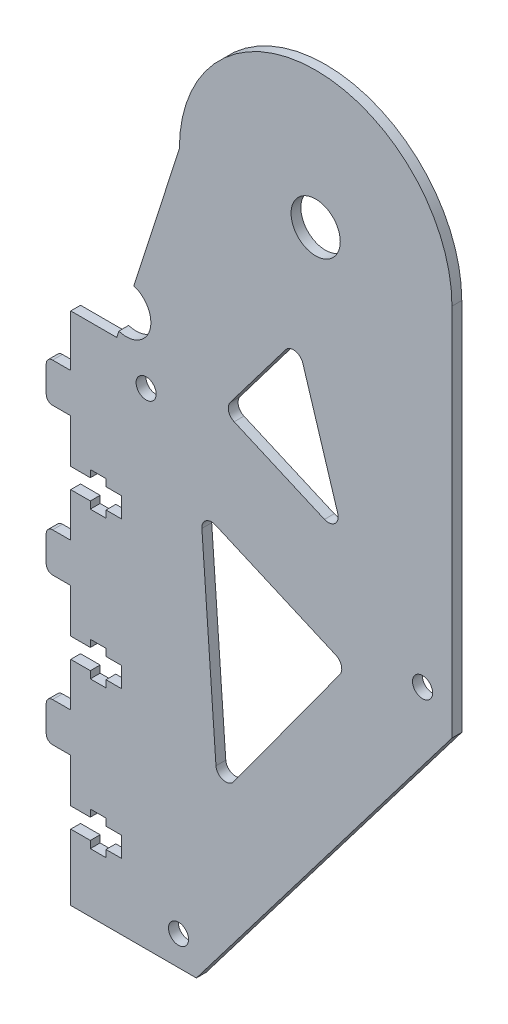
from build123d import *

# Parameters (mm, degrees)
SKETCH_1_R          = 5.0225
SKETCH_1_R_2        = 2.05
EXTRUDE_1_DEPTH     = 2
FILLET_1_R          = 2
FILLET_2_R          = 1.3
SKETCH_3_R          = 5
CUT_EXTRUDE_1_DEPTH = 2


with BuildPart() as part:
    # 草图1 → 凸台-拉伸1 (new body)
    with BuildSketch(Plane.XY):
        with BuildLine():
            Line((298.545628784, -83.894391363), (298.545628784, -92.841778663))
            Line((298.545628784, -92.841778663), (302.545628784, -92.841778663))
            Line((302.545628784, -92.841778663), (302.545628784, -91.391778663))
            Line((302.545628784, -91.391778663), (305.745628784, -91.391778663))
            Line((305.745628784, -91.391778663), (305.745628784, -92.841778663))
            Line((305.745628784, -92.841778663), (308.945628784, -92.841778663))
            Line((308.945628784, -92.841778663), (308.945628784, -96.941778663))
            Line((308.945628784, -96.941778663), (305.745628784, -96.941778663))
            Line((305.745628784, -96.941778663), (305.745628784, -98.391778663))
            Line((305.745628784, -98.391778663), (302.545628784, -98.391778663))
            Line((302.545628784, -98.391778663), (302.545628784, -96.941778663))
            Line((302.545628784, -96.941778663), (298.545628784, -96.941778663))
            Line((298.545628784, -96.941778663), (298.545628784, -105.894391358))
            Line((298.545628784, -105.894391358), (293.545628784, -105.894391358))
            Line((293.545628784, -105.894391358), (293.545628784, -113.894391358))
            Line((293.545628784, -113.894391358), (298.545628784, -113.894391358))
            Line((298.545628784, -113.894391358), (298.545628784, -122.847004054))
            Line((298.545628784, -122.847004054), (302.545628784, -122.847004054))
            Line((302.545628784, -122.847004054), (302.545628784, -121.397004054))
            Line((302.545628784, -121.397004054), (305.745628784, -121.397004054))
            Line((305.745628784, -121.397004054), (305.745628784, -122.847004054))
            Line((305.745628784, -122.847004054), (308.945628784, -122.847004054))
            Line((308.945628784, -122.847004054), (308.945628784, -126.947004054))
            Line((308.945628784, -126.947004054), (305.745628784, -126.947004054))
            Line((305.745628784, -126.947004054), (305.745628784, -128.397004054))
            Line((305.745628784, -128.397004054), (302.545628784, -128.397004054))
            Line((302.545628784, -128.397004054), (302.545628784, -126.947004054))
            Line((302.545628784, -126.947004054), (298.545628784, -126.947004054))
            Line((298.545628784, -126.947004054), (298.545628784, -140.447004054))
            Line((298.545628784, -140.447004054), (324.188862368, -140.447004054))
            Line((324.188862368, -140.447004054), (376.358604426, -71.946984141))
            Line((376.358604426, -71.946984141), (376.358604426, 4.396201153))
            ThreePointArc((376.358604426, 4.396201153), (348.536987634, 32.217817945), (320.715370843, 4.396201153))
            Line((320.715370843, 4.396201153), (307.936987634, -35.346984141))
            Line((307.936987634, -35.346984141), (298.545628784, -35.346984141))
            Line((298.545628784, -35.346984141), (298.545628784, -45.889165972))
            Line((298.545628784, -45.889165972), (293.545628784, -45.889165972))
            Line((293.545628784, -45.889165972), (293.545628784, -53.889165972))
            Line((293.545628784, -53.889165972), (298.545628784, -53.889165972))
            Line((298.545628784, -53.889165972), (298.545628784, -62.841778668))
            Line((298.545628784, -62.841778668), (302.545628784, -62.841778668))
            Line((302.545628784, -62.841778668), (302.545628784, -61.391778668))
            Line((302.545628784, -61.391778668), (305.745628784, -61.391778668))
            Line((305.745628784, -61.391778668), (305.745628784, -62.841778668))
            Line((305.745628784, -62.841778668), (308.945628784, -62.841778668))
            Line((308.945628784, -62.841778668), (308.945628784, -66.941778668))
            Line((308.945628784, -66.941778668), (305.745628784, -66.941778668))
            Line((305.745628784, -66.941778668), (305.745628784, -68.391778668))
            Line((305.745628784, -68.391778668), (302.545628784, -68.391778668))
            Line((302.545628784, -68.391778668), (302.545628784, -66.941778668))
            Line((302.545628784, -66.941778668), (298.545628784, -66.941778668))
            Line((298.545628784, -66.941778668), (298.545628784, -75.894391363))
            Line((298.545628784, -75.894391363), (293.545628784, -75.894391363))
            Line((293.545628784, -75.894391363), (293.545628784, -83.894391363))
            Line((293.545628784, -83.894391363), (298.545628784, -83.894391363))
        make_face()
        with Locations((348.536987634, 4.396201153)):
            Circle(SKETCH_1_R, mode=Mode.SUBTRACT)
        with Locations((320.545628784, -134.447004054)):
            Circle(SKETCH_1_R_2, mode=Mode.SUBTRACT)
        with Locations((370.358604426, -65.946984141)):
            Circle(SKETCH_1_R_2, mode=Mode.SUBTRACT)
        with Locations((313.936987634, -41.346984141)):
            Circle(SKETCH_1_R_2, mode=Mode.SUBTRACT)
        Polygon((354.947285032, -70.136765586), (328.579617375, -106.396108383), (325.08144343, -57.115165973), align=None, mode=Mode.SUBTRACT)
        Polygon((329.571126451, -37.254352656), (354.337315751, -48.052488042), (344.758747766, -17.175445836), align=None, mode=Mode.SUBTRACT)
    extrude(amount=EXTRUDE_1_DEPTH)

    # 圆角1
    fillet_1_edges = [part.edges().sort_by_distance(p)[0] for p in [
        (344.758747766, -17.175445836, 1),
        (329.571126451, -37.254352656, 1),
        (354.337315751, -48.052488042, 1),
        (325.08144343, -57.115165973, 1),
        (328.579617375, -106.396108383, 1),
        (354.947285032, -70.136765586, 1),
    ]]
    fillet(fillet_1_edges, radius=FILLET_1_R)

    # 圆角2
    fillet_2_edges = [part.edges().sort_by_distance(p)[0] for p in [
        (293.545628784, -45.889165972, 1),
        (293.545628784, -53.889165972, 1),
        (293.545628784, -83.894391363, 1),
        (293.545628784, -75.894391363, 1),
        (293.545628784, -113.894391358, 1),
        (293.545628784, -105.894391358, 1),
    ]]
    fillet(fillet_2_edges, radius=FILLET_2_R)

    # 草图3 → 切除-拉伸1 (cut)
    with BuildSketch(Plane(origin=(0, 0, 0), x_dir=(-1, 0, 0), z_dir=(0, 0, -1))):
        with Locations((-309.899887982, -29.241993317)):
            Circle(SKETCH_3_R)
    extrude(amount=-CUT_EXTRUDE_1_DEPTH, mode=Mode.SUBTRACT)


solid = part.part
